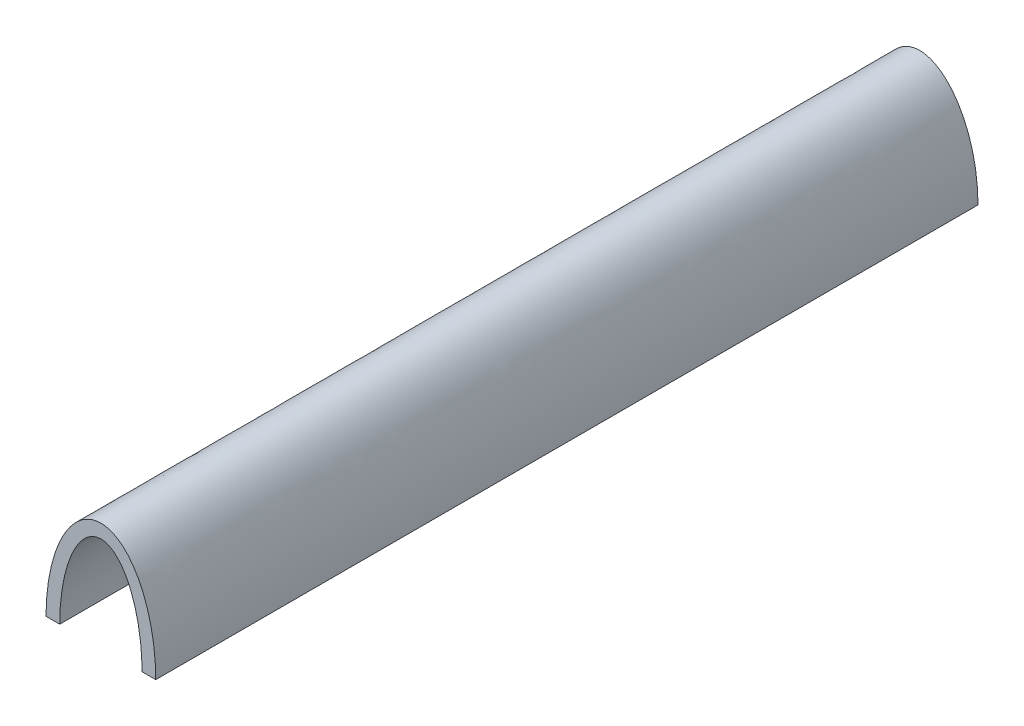
from build123d import *

# Parameters (mm, degrees)
BOSS_EXTRUDE1_START   = 159.148232688
BOSS_EXTRUDE1_DEPTH   = 450.451767312
BOSS_EXTRUDE1_START_2 = -1
BOSS_EXTRUDE1_2_DEPTH = 41
SKETCH2_W             = 40
SKETCH2_H             = 150.75
CUT_EXTRUDE1_DEPTH    = 612.199118568


with BuildPart() as part:
    # Boss-Extrude1: read off the stored shape, not the designer's step
    # Boss-Extrude1 outline → Boss-Extrude1 (new body)
    with BuildSketch(Plane.XY.offset(BOSS_EXTRUDE1_START)):
        with BuildLine():
            add(Edge.make_bspline(
                [(20, 0), (20, 39.398), (0, 39.398), (-20, 39.398), (-20, 0)],
                knots=[4.71238898, 4.71238898, 4.71238898, 6.283185307, 6.283185307, 7.853981634, 7.853981634, 7.853981634], degree=2, weights=[1, 0.707106781, 1, 0.707106781, 1]))
            Line((-20, 0), (-15, 0))
            add(Edge.make_bspline(
                [(-15, 0), (-15, 34.398), (0, 34.398), (15, 34.398), (15, 0)],
                knots=[4.71238898, 4.71238898, 4.71238898, 6.283185307, 6.283185307, 7.853981634, 7.853981634, 7.853981634], degree=2, weights=[1, 0.707106781, 1, 0.707106781, 1]))
            Line((15, 0), (20, 0))
        make_face()
    extrude(amount=BOSS_EXTRUDE1_DEPTH)

    # Boss-Extrude1 2 outline → Boss-Extrude1 2 (cut)
    with BuildSketch(Plane(origin=(0, 0, 0), x_dir=(1, 0, 0), z_dir=(0, 1, 0)).offset(BOSS_EXTRUDE1_START_2)):
        with BuildLine():
            Line((20, -159.148232789), (-20, -159.148232789))
            ThreePointArc((-20, -159.148232789), (0, -160.4), (20, -159.148232789))
        make_face()
    extrude(amount=BOSS_EXTRUDE1_2_DEPTH, mode=Mode.SUBTRACT)

    # Sketch2 → Cut-Extrude1 (cut, through all)
    with BuildSketch(Plane.XZ):
        with Locations((0, 534.225)):
            Rectangle(SKETCH2_W, SKETCH2_H)
    extrude(amount=-CUT_EXTRUDE1_DEPTH, mode=Mode.SUBTRACT)


solid = part.part
